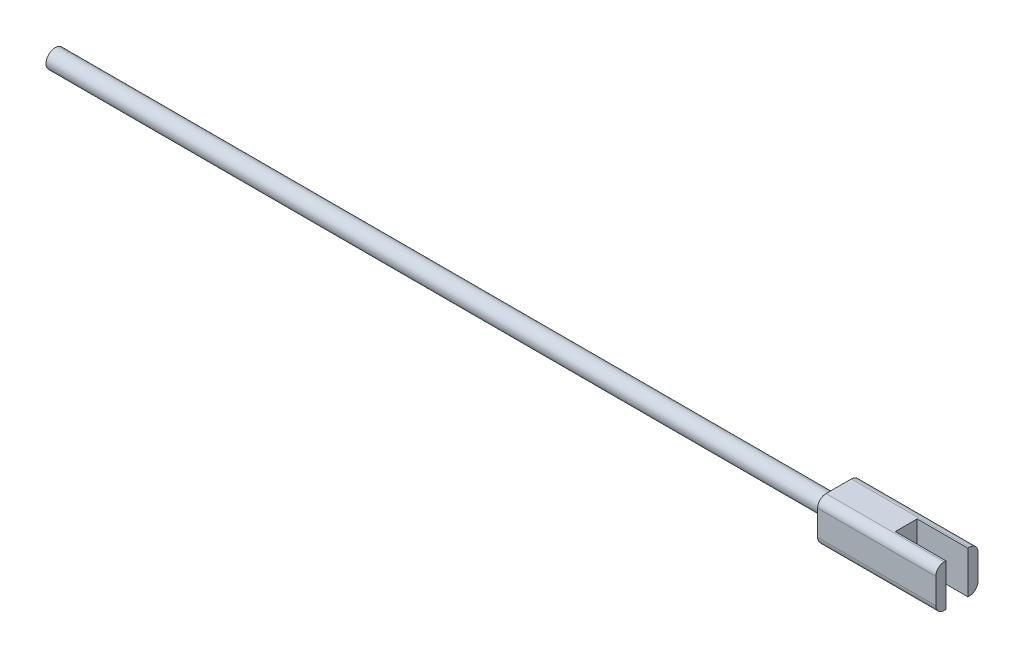
from build123d import *

# Parameters (mm, degrees)
SKETCH1_R               = 1.09
BOSS_EXTRUDE1_DEPTH     = 94.829
BOSS_EXTRUDE2_DEPTH     = 14
CUT_EXTRUDE1_DEPTH      = 107.887488702
CUT_EXTRUDE1_DEPTH_BACK = 107.887488702
SKETCH3_W               = 7
SKETCH3_H               = 2.6


with BuildPart() as part:
    # Sketch1 → Boss-Extrude1 (new body)
    with BuildSketch(Plane(origin=(0, 0, 0), x_dir=(0, 0, -1), z_dir=(1, 0, 0))):
        Circle(SKETCH1_R)
    extrude(amount=BOSS_EXTRUDE1_DEPTH)

    # Sketch2 → Boss-Extrude2 (add)
    with BuildSketch(Plane(origin=(92.829, 0, 0), x_dir=(0, 0, -1), z_dir=(1, 0, 0))):
        with BuildLine():
            Line((-1.5, -2.5), (1.5, -2.5))
            ThreePointArc((1.5, -2.5), (2.207106781, -2.207106781), (2.5, -1.5))
            Line((2.5, -1.5), (2.5, 1.5))
            ThreePointArc((2.5, 1.5), (2.207106781, 2.207106781), (1.5, 2.5))
            Line((1.5, 2.5), (-1.5, 2.5))
            ThreePointArc((-1.5, 2.5), (-2.207106781, 2.207106781), (-2.5, 1.5))
            Line((-2.5, 1.5), (-2.5, -1.5))
            ThreePointArc((-2.5, -1.5), (-2.207106781, -2.207106781), (-1.5, -2.5))
        make_face()
    extrude(amount=BOSS_EXTRUDE2_DEPTH)

    # Sketch3 → Cut-Extrude1 (cut, two sides: drawn at the far end of the back side and taken through both)
    with BuildSketch(Plane(origin=(0, 0, 0), x_dir=(1, 0, 0), z_dir=(0, 1, 0)).offset(-CUT_EXTRUDE1_DEPTH_BACK)):
        with Locations((104.329, 0)):
            Rectangle(SKETCH3_W, SKETCH3_H)
    extrude(amount=CUT_EXTRUDE1_DEPTH + CUT_EXTRUDE1_DEPTH_BACK, mode=Mode.SUBTRACT)


solid = part.part
